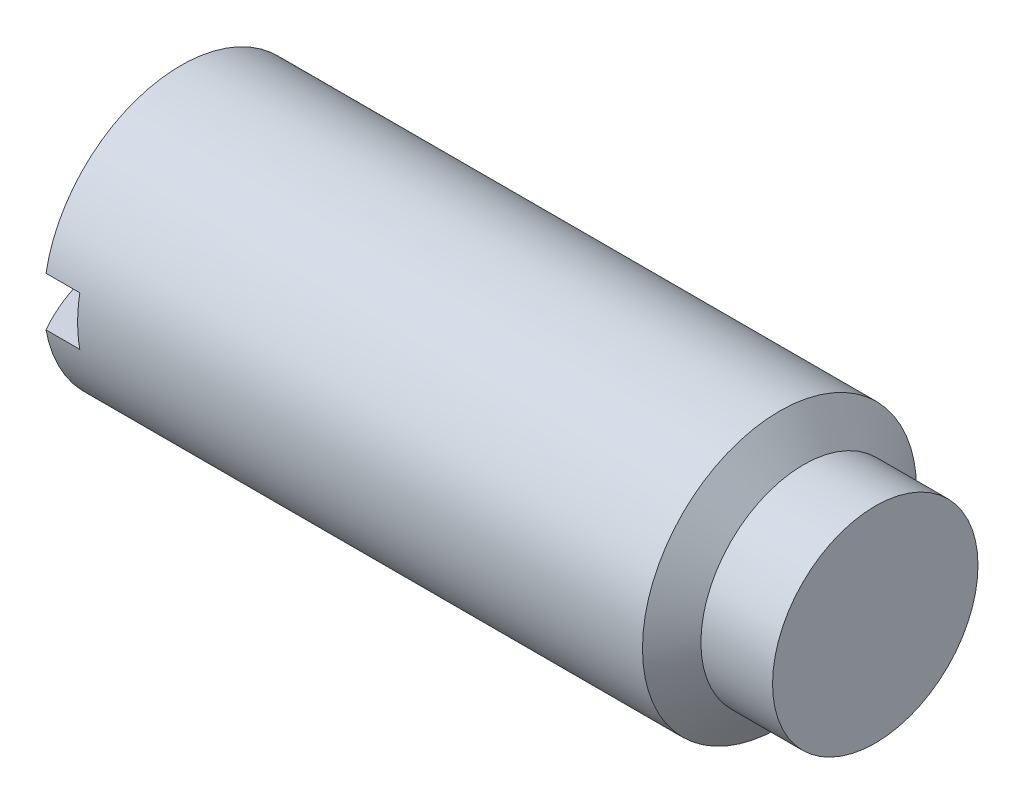
from build123d import *

# Parameters (mm, degrees)
SKETCH2_W  = 19.05
SKETCH2_H  = 3.4036
SLOT_DEPTH = 4.9022


with BuildPart() as part:
    # BodySke → BaseBody (revolve)
    with BuildSketch(Plane.XY):
        with BuildLine():
            Line((45.8216, 7.1374), (50.8, 7.1374))
            Line((50.8, 7.1374), (50.8, 0))
            Line((50.8, 0), (0, 0))
            ThreePointArc((0, 0), (0.649113009, 4.930502809), (2.552216058, 9.525))
            Line((2.552216058, 9.525), (44.149784482, 9.525))
            Line((44.149784482, 9.525), (45.8216, 7.1374))
        make_face()
    revolve(axis=Axis((-12.7, 0, 0), (1, 0, 0)))

    # Sketch2 → Slot (cut)
    with BuildSketch(Plane(origin=(0, 0, 0), x_dir=(0, 0, -1), z_dir=(1, 0, 0))):
        Rectangle(SKETCH2_W, SKETCH2_H)
    extrude(amount=SLOT_DEPTH, mode=Mode.SUBTRACT)


solid = part.part
